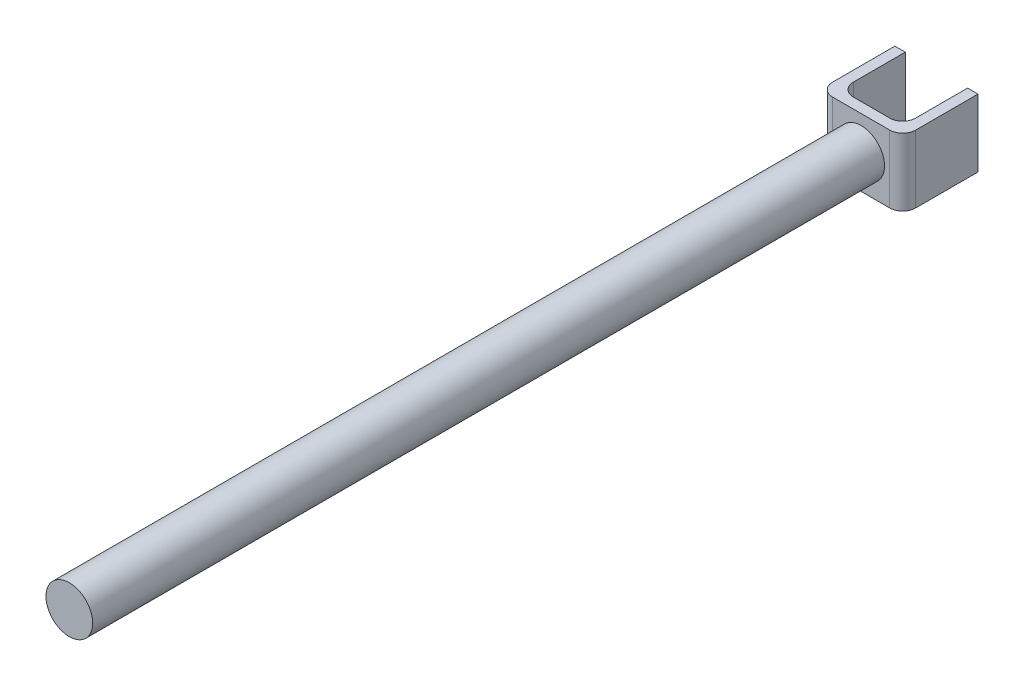
from build123d import *

# Parameters (mm, degrees)
BOSS_EXTRUDE1_DEPTH      = 13
BOSS_EXTRUDE1_DEPTH_BACK = 13
SKETCH2_R                = 9
BOSS_EXTRUDE2_DEPTH      = 305


with BuildPart() as part:
    # Sketch1 → Boss-Extrude1 (new, two sides: drawn at the far end of the back side and taken through both)
    with BuildSketch(Plane(origin=(0, 0, 0), x_dir=(1, 0, 0), z_dir=(0, 1, 0)).offset(-BOSS_EXTRUDE1_DEPTH_BACK)):
        with BuildLine():
            Line((7, -20.776256957), (-7, -20.776256957))
            ThreePointArc((-7, -20.776256957), (-10.535533906, -19.311790863), (-12, -15.776256957))
            Line((-12, -15.776256957), (-12, 4.223743043))
            Line((-12, 4.223743043), (-16, 4.223743043))
            Line((-16, 4.223743043), (-16, -19.776256957))
            ThreePointArc((-16, -19.776256957), (-14.535533906, -23.311790863), (-11, -24.776256957))
            Line((-11, -24.776256957), (11, -24.776256957))
            ThreePointArc((11, -24.776256957), (14.535533906, -23.311790863), (16, -19.776256957))
            Line((16, -19.776256957), (16, 4.223743043))
            Line((16, 4.223743043), (12, 4.223743043))
            Line((12, 4.223743043), (12, -15.776256957))
            ThreePointArc((12, -15.776256957), (10.535533906, -19.311790863), (7, -20.776256957))
        make_face()
    extrude(amount=BOSS_EXTRUDE1_DEPTH + BOSS_EXTRUDE1_DEPTH_BACK)

    # Sketch2 → Boss-Extrude2 (add)
    with BuildSketch(Plane.XY.offset(24.776256957)):
        Circle(SKETCH2_R)
    extrude(amount=BOSS_EXTRUDE2_DEPTH)


solid = part.part
